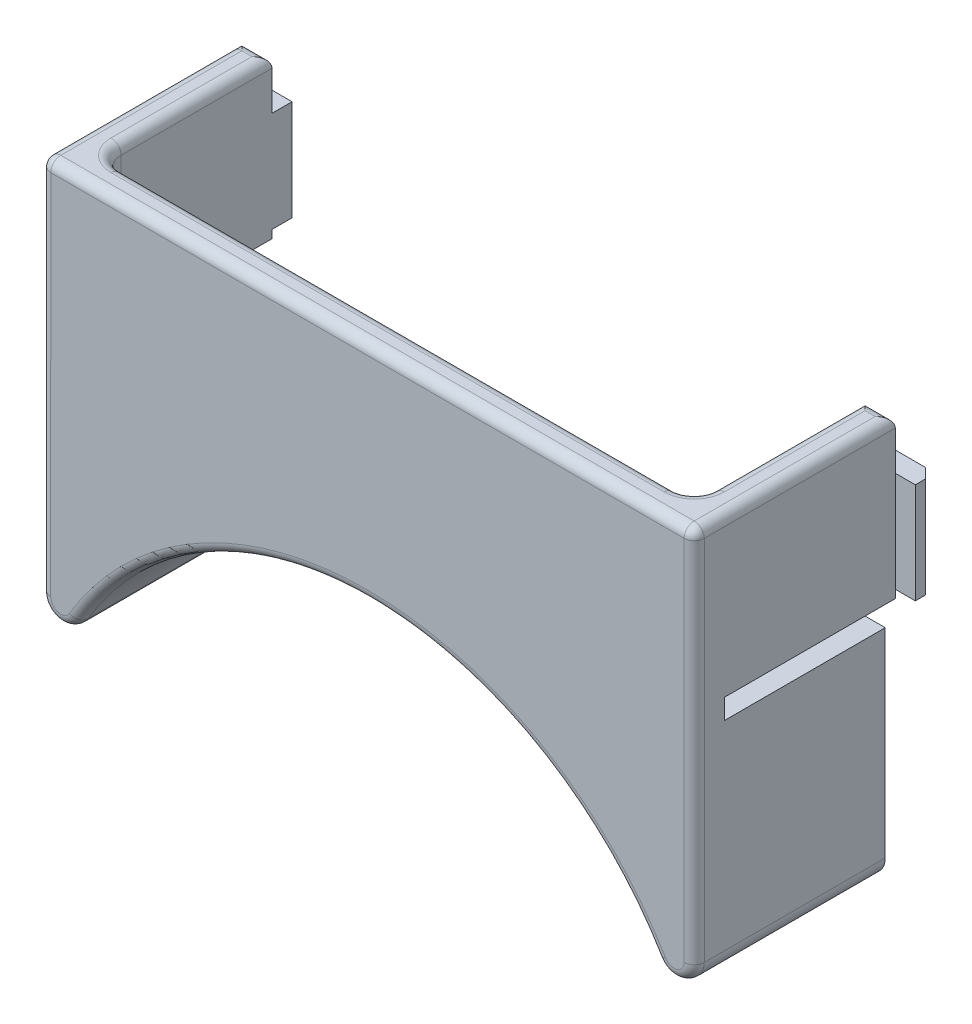
from build123d import *

# Parameters (mm, degrees)
BOSS_EXTRUDE1_DEPTH = 1.9
SKETCH2_W           = 6.499536779
SKETCH2_H           = 1.569153834
BOSS_EXTRUDE2_DEPTH = 0.1
BOSS_EXTRUDE3_START = -0.3
SKETCH3_W           = 0.2
SKETCH3_H           = 1
BOSS_EXTRUDE3_DEPTH = 0.5
SKETCH4_W           = 5.899073558
SKETCH4_H           = 2.069153834
CUT_EXTRUDE1_DEPTH  = 1.7
CHAMFER1_SIZE       = 0.1
SKETCH5_W           = 0.32618924
SKETCH5_H           = 0.2
CUT_EXTRUDE2_DEPTH  = 1.6
FILLET1_R           = 0.2
FILLET2_R           = 0.2
FILLET3_R           = 0.1


with BuildPart() as part:
    # Sketch1 → Boss-Extrude1 (new body)
    with BuildSketch(Plane.XY):
        with BuildLine():
            Line((3.25, -5.898632739), (-3.249536779, -5.898632739))
            Line((-3.249536779, -5.898632739), (-3.25, -10.655382732))
            ThreePointArc((-3.25, -10.655382732), (0, -8.117786573), (3.25, -10.655382732))
            Line((3.25, -10.655382732), (3.25, -5.898632739))
        make_face()
    extrude(amount=-BOSS_EXTRUDE1_DEPTH)

    # Sketch2 → Boss-Extrude2 (add)
    with BuildSketch(Plane(origin=(0, 0, -1.9), x_dir=(-1, 0, 0), z_dir=(0, 0, -1))):
        with Locations((-0.00023161, -6.683209656)):
            Rectangle(SKETCH2_W, SKETCH2_H)
    extrude(amount=BOSS_EXTRUDE2_DEPTH)

    # Sketch3 → Boss-Extrude3 (add)
    with BuildSketch(Plane.ZY.offset(3.249536779).offset(BOSS_EXTRUDE3_START)):
        with Locations((-2.1, -6.887362902)):
            Rectangle(SKETCH3_W, SKETCH3_H)
    boss_extrude3 = extrude(amount=BOSS_EXTRUDE3_DEPTH)

    # Mirror1: Boss-Extrude3 across plane
    add(boss_extrude3.mirror(Plane(origin=(0, 0, 0), x_dir=(0, 0, 1), z_dir=(1, 0, 0))))

    # Sketch4 → Cut-Extrude1 (cut)
    with BuildSketch(Plane(origin=(0, 0, -2), x_dir=(-1, 0, 0), z_dir=(0, 0, -1))):
        with Locations((0, -6.933209656)):
            Rectangle(SKETCH4_W, SKETCH4_H)
    extrude(amount=-CUT_EXTRUDE1_DEPTH, mode=Mode.SUBTRACT)

    # Chamfer1
    chamfer1_edges = [part.edges().sort_by_distance(p)[0] for p in [
        (-3.449536779, -6.887362902, -2.2),
        (3.449536779, -6.887362902, -2.2),
    ]]
    chamfer(chamfer1_edges, length=CHAMFER1_SIZE)

    # Sketch5 → Cut-Extrude2 (cut)
    with BuildSketch(Plane(origin=(0, 0, -1.9), x_dir=(-1, 0, 0), z_dir=(0, 0, -1))):
        with Locations((3.112631399, -7.567786573)):
            Rectangle(SKETCH5_W, SKETCH5_H)
        with Locations((-3.112631399, -7.567786573)):
            Rectangle(SKETCH5_W, SKETCH5_H)
    extrude(amount=-CUT_EXTRUDE2_DEPTH, mode=Mode.SUBTRACT)

    # Fillet1
    fillet1_edges = [part.edges().sort_by_distance(p)[0] for p in [
        (2.949536779, -6.683209656, -0.3),
        (2.949536779, -7.967786573, -1.1),
        (0, -7.967786573, -0.3),
        (-2.949536779, -7.967786573, -1.1),
        (-2.949536779, -7.817786573, -0.3),
        (-2.949536779, -6.683209656, -0.3),
        (2.949536779, -7.817786573, -0.3),
    ]]
    fillet(fillet1_edges, radius=FILLET1_R)

    # Fillet2
    fillet2_edges = [part.edges().sort_by_distance(p)[0] for p in [
        (-3.25, -10.655382732, -0.95),
        (3.25, -10.655382732, -0.95),
    ]]
    fillet(fillet2_edges, radius=FILLET2_R)

    # Fillet3
    # the kernel refuses this fillet: 0.1 mm, written as the material it takes off along each edge
    with BuildSketch(Plane(origin=(3.15, -5.998632739, -0.1), x_dir=(1, 0, 0), z_dir=(0, 0, 1))) as fillet3_piece_1_section:
        Polygon((0, 0), (FILLET3_R, 0), (FILLET3_R, FILLET3_R), (0, FILLET3_R), align=None)
    fillet3_piece_1 = extrude(amount=FILLET3_R, mode=Mode.PRIVATE)
    fillet3_piece_1 = fillet3_piece_1 - Plane(origin=(3.15, -5.998632739, -0.1), x_dir=(-0.7071067811865476, -0.7071067811865475, 0), z_dir=(0, 0, 1)) * Sphere(FILLET3_R, mode=Mode.PRIVATE)
    add(fillet3_piece_1, mode=Mode.SUBTRACT)
    with BuildSketch(Plane(origin=(-3.149546516, -5.998632739, -0.1), x_dir=(0, 1, 0), z_dir=(0, 0, 1))) as fillet3_piece_2_section:
        Polygon((0, 0), (FILLET3_R, 0), (FILLET3_R, FILLET3_R * 0.999902622813), (FILLET3_R * 9.738192815e-05, FILLET3_R * 0.999999995258), align=None)
    fillet3_piece_2 = extrude(amount=FILLET3_R, mode=Mode.PRIVATE)
    fillet3_piece_2 = fillet3_piece_2 - Plane(origin=(-3.149546516, -5.998632739, -0.1), x_dir=(0.7070723506374189, -0.7071412100592604, 0), z_dir=(0, 0, 1)) * Sphere(FILLET3_R, mode=Mode.PRIVATE)
    add(fillet3_piece_2, mode=Mode.SUBTRACT)
    with BuildSketch(Plane(origin=(3.25, -9.65119636, 0), x_dir=(-1, 0, 0), z_dir=(0, 1, 0))) as fillet3_piece_3:
        with BuildLine():
            CenterArc((FILLET3_R, -FILLET3_R), FILLET3_R, 90, 90)
            Line((0, -FILLET3_R), (0, 0))
            Line((0, 0), (FILLET3_R, 0))
        make_face()
    extrude(amount=3.652563621, mode=Mode.SUBTRACT)
    with BuildSketch(Plane(origin=(3.05, -9.65119636, 0), x_dir=(-0.8591549295774534, -0.511715552805229, 0), z_dir=(-0.511715552805229, 0.8591549295774534, 0))) as fillet3_piece_4:
        with BuildLine():
            CenterArc((0.2 - FILLET3_R, -FILLET3_R), FILLET3_R, 0, 90)
            Line((0.2, -FILLET3_R), (0.2, 0))
            Line((0.2, 0), (0.2 - FILLET3_R, 0))
        make_face()
    revolve(axis=Axis((3.05, -9.65119636, 0), (0, 0, 1)), revolution_arc=149.221830438, mode=Mode.SUBTRACT)
    with BuildSketch(Plane(origin=(0, -11.467786573, 0), x_dir=(-0.8591273784381983, 0.5117618075021901, 0), z_dir=(-0.5117618075021901, -0.8591273784381983, 0))) as fillet3_piece_5:
        with BuildLine():
            CenterArc((3.35 + FILLET3_R, FILLET3_R), FILLET3_R, 180, 90)
            Line((3.35, FILLET3_R), (3.35, 0))
            Line((3.35, 0), (3.35 + FILLET3_R, 0))
        make_face()
    revolve(axis=Axis((0, -11.467786573, 0), (0, 0, -1)), revolution_arc=118.440576169, mode=Mode.SUBTRACT)
    with BuildSketch(Plane(origin=(-3.049902193, -9.651032156, 0), x_dir=(0.8591273784382029, -0.5117618075021826, 0), z_dir=(0.5117618075021826, 0.8591273784382029, 0))) as fillet3_piece_6:
        with BuildLine():
            CenterArc((0.2 - FILLET3_R, FILLET3_R), FILLET3_R, 270, 90)
            Line((0.2, FILLET3_R), (0.2, 0))
            Line((0.2, 0), (0.2 - FILLET3_R, 0))
        make_face()
    revolve(axis=Axis((-3.049902193, -9.651032156, 0), (0, 0, -1)), revolution_arc=149.224325304, mode=Mode.SUBTRACT)
    with BuildSketch(Plane(origin=(-3.249546516, -5.998623001, 0), x_dir=(0.99999999525838, -9.738192814999169e-05, 0), z_dir=(-9.73819281499917e-05, -0.9999999952583801, 0))) as fillet3_piece_7:
        with BuildLine():
            CenterArc((FILLET3_R, -FILLET3_R), FILLET3_R, 90, 90)
            Line((0, -FILLET3_R), (0, 0))
            Line((0, 0), (FILLET3_R, 0))
        make_face()
    extrude(amount=3.652389696, mode=Mode.SUBTRACT)
    with BuildSketch(Plane(origin=(3.25, -5.898632739, -0.1), x_dir=(0, -1, 0), z_dir=(0, 0, -1))) as fillet3_piece_8:
        with BuildLine():
            CenterArc((FILLET3_R, FILLET3_R), FILLET3_R, 180, 90)
            Line((0, FILLET3_R), (0, 0))
            Line((0, 0), (FILLET3_R, 0))
        make_face()
    extrude(amount=1.8, mode=Mode.SUBTRACT)
    with BuildSketch(Plane(origin=(3.15, -5.898632739, 0), x_dir=(0, -1, 0), z_dir=(-1, 0, 0))) as fillet3_piece_9:
        with BuildLine():
            CenterArc((FILLET3_R, -FILLET3_R), FILLET3_R, 90, 90)
            Line((0, -FILLET3_R), (0, 0))
            Line((0, 0), (FILLET3_R, 0))
        make_face()
    extrude(amount=6.299546516, mode=Mode.SUBTRACT)
    with BuildSketch(Plane(origin=(-3.249536779, -5.898632739, -0.1), x_dir=(1, 0, 0), z_dir=(0, 0, -1))) as fillet3_piece_10:
        with BuildLine():
            CenterArc((FILLET3_R * 0.999902622813, FILLET3_R), FILLET3_R, 180.005579573, 89.994420427)
            Line((-FILLET3_R * 9.73724453734e-05, FILLET3_R * 0.999902618072), (0, 0))
            Line((0, 0), (FILLET3_R * 0.999902622813, 0))
        make_face()
    extrude(amount=1.8, mode=Mode.SUBTRACT)
    with BuildSketch(Plane(origin=(-3.249536779, -5.898632739, -1.9), x_dir=(1.0, -4.7416204296268874e-09, 0), z_dir=(0, 0, -1)), Plane(origin=(3.25, -5.898632739, -1.9), x_dir=(0, -1, 0), z_dir=(0, 0, -1))) as fillet3_piece_11:
        with BuildLine():
            CenterArc((FILLET3_R * 1.00000000474, FILLET3_R), FILLET3_R, 179.999999728, 90)
            Line((FILLET3_R * 4.74162045211e-09, FILLET3_R * 1.00000000474), (0, 0))
            Line((0, 0), (FILLET3_R, 0))
        make_face()
    extrude(amount=0.350000001, mode=Mode.SUBTRACT)
    with BuildSketch(Plane(origin=(-3.49953678, -5.898632739, -2), x_dir=(0, -4.7416204296268874e-09, 1.0), z_dir=(1, 0, 0))) as fillet3_piece_12:
        with BuildLine():
            CenterArc((FILLET3_R * 1.00000000474, FILLET3_R), FILLET3_R, 179.999999728, 90)
            Line((FILLET3_R * 4.74162045211e-09, FILLET3_R * 1.00000000474), (0, 0))
            Line((0, 0), (FILLET3_R, 0))
        make_face()
    extrude(amount=0.800000002, mode=Mode.SUBTRACT)
    with BuildSketch(Plane(origin=(-2.949536779, -5.898632739, -2.250000001), x_dir=(-1.0, -4.7416204296268874e-09, 0), z_dir=(0, 0, 1))) as fillet3_piece_13:
        with BuildLine():
            CenterArc((FILLET3_R * 1.00000000474, FILLET3_R), FILLET3_R, 179.999999728, 90)
            Line((FILLET3_R * 4.74162045211e-09, FILLET3_R * 1.00000000474), (0, 0))
            Line((0, 0), (FILLET3_R, 0))
        make_face()
    extrude(amount=1.750000001, mode=Mode.SUBTRACT)
    with BuildSketch(Plane(origin=(-2.749536779, -5.898632739, -0.5), x_dir=(0, 0, 1), z_dir=(1, 0, 0))) as fillet3_piece_14:
        with BuildLine():
            CenterArc((0.2 + FILLET3_R, FILLET3_R), FILLET3_R, 180, 90)
            Line((0.2, FILLET3_R), (0.2, 0))
            Line((0.2, 0), (0.2 + FILLET3_R, 0))
        make_face()
    revolve(axis=Axis((-2.749536779, -5.898632739, -0.5), (0, -1, 0)), revolution_arc=90, mode=Mode.SUBTRACT)
    with BuildSketch(Plane(origin=(-2.749536779, -5.898632739, -0.3), x_dir=(0, -4.7416204296268916e-09, 1.0), z_dir=(1, 0, 0))) as fillet3_piece_15:
        with BuildLine():
            CenterArc((FILLET3_R * 1.00000000474, FILLET3_R), FILLET3_R, 179.999999728, 90)
            Line((FILLET3_R * 4.74162045211e-09, FILLET3_R * 1.00000000474), (0, 0))
            Line((0, 0), (FILLET3_R, 0))
        make_face()
    extrude(amount=5.499073557, mode=Mode.SUBTRACT)
    with BuildSketch(Plane(origin=(2.749536779, -5.898632739, -0.5), x_dir=(0, 0, 1), z_dir=(-1, 0, 0))) as fillet3_piece_16:
        with BuildLine():
            CenterArc((0.2 + FILLET3_R, -FILLET3_R), FILLET3_R, 90, 90)
            Line((0.2, -FILLET3_R), (0.2, 0))
            Line((0.2, 0), (0.2 + FILLET3_R, 0))
        make_face()
    revolve(axis=Axis((2.749536779, -5.898632739, -0.5), (0, 1, 0)), revolution_arc=90, mode=Mode.SUBTRACT)
    with BuildSketch(Plane(origin=(2.949536779, -5.898632739, -2.250000001), x_dir=(1.0, -4.7416204296268874e-09, 0), z_dir=(0, 0, 1))) as fillet3_piece_17:
        with BuildLine():
            CenterArc((FILLET3_R * 1.00000000474, -FILLET3_R), FILLET3_R, 90.000000272, 90)
            Line((FILLET3_R * 4.74162045211e-09, -FILLET3_R * 1.00000000474), (0, 0))
            Line((0, 0), (FILLET3_R, 0))
        make_face()
    extrude(amount=1.750000001, mode=Mode.SUBTRACT)
    with BuildSketch(Plane(origin=(2.699536777, -5.898632739, -2), x_dir=(0, -4.7416204296268874e-09, 1.0), z_dir=(1, 0, 0))) as fillet3_piece_18:
        with BuildLine():
            CenterArc((FILLET3_R * 1.00000000474, FILLET3_R), FILLET3_R, 179.999999728, 90)
            Line((FILLET3_R * 4.74162045211e-09, FILLET3_R * 1.00000000474), (0, 0))
            Line((0, 0), (FILLET3_R, 0))
        make_face()
    extrude(amount=0.800463224, mode=Mode.SUBTRACT)


solid = part.part
